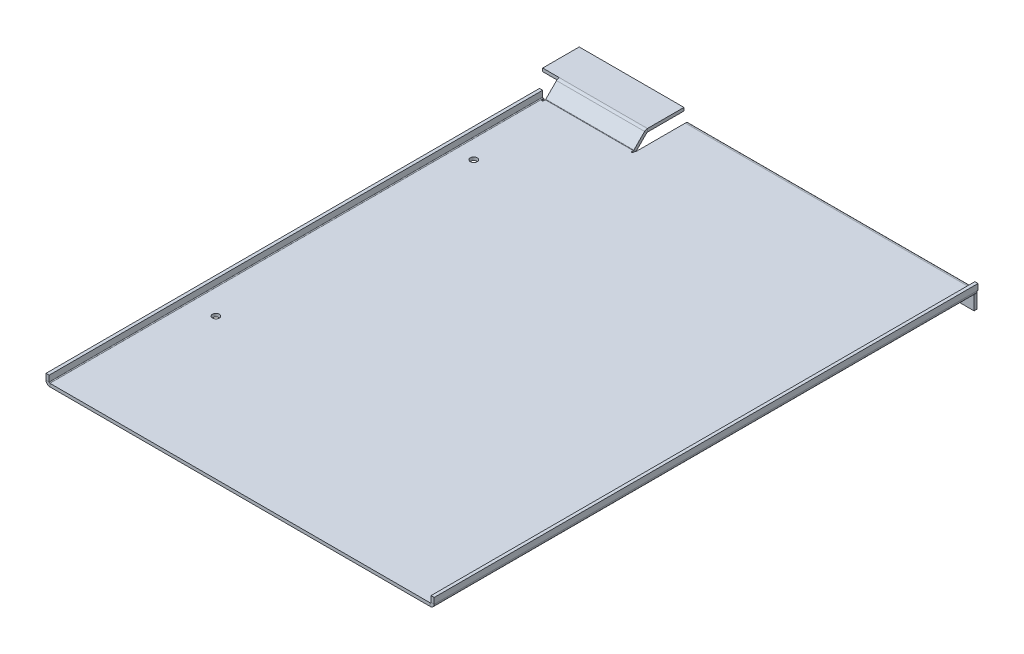
from build123d import *

# Parameters (mm, degrees)
SM_BASE_FLANGE_1_DEPTH           = 3
SM_EDGE_FLANGE_1_STRIP_W         = 13.48
SM_EDGE_FLANGE_1_STRIP_H         = 3
SM_EDGE_FLANGE_1_STRIP_CUT_DEPTH = 466.526743508
SM_EDGE_FLANGE_1_DEPTH           = 466.526743508
SM_EDGE_FLANGE_2_STRIP_W         = 13.48
SM_EDGE_FLANGE_2_STRIP_H         = 3
SM_EDGE_FLANGE_2_STRIP_CUT_DEPTH = 514.106826818
SM_EDGE_FLANGE_2_DEPTH           = 514.106826818
SM_START                         = -362.76
SM_EDGE_FLANGE_5_DEPTH           = 86.26
SM_START_2                       = -361.26
SM_EDGE_FLANGE_5_2_DEPTH         = 83.26
SM_START_3                       = -1
SM_EDGE_FLANGE_5_3_DEPTH         = 4.216740982
SM_EDGE_FLANGE_6_STRIP_CUT_DEPTH = 83.26
SM_EDGE_FLANGE_6_DEPTH           = 83.26
SM_START_4                       = 3
SM_EDGE_FLANGE_6_PROFILE_W       = 99
SM_EDGE_FLANGE_6_PROFILE_H       = 34.545643213
SM_EDGE_FLANGE_6_FLAT_DEPTH      = 3
SM_START_5                       = -3.74
SM_EDGE_FLANGE_7_DEPTH           = 4.74
SM_START_6                       = -276
SM_EDGE_FLANGE_7_2_DEPTH         = 272.26
SM_EDGE_FLANGE_7_3_DEPTH         = 272.26
SKETCH_29_R                      = 3.25
CUT_EXTRUDE_1_DEPTH              = 5


with BuildPart() as part:
    # Базовая кромка1: sheet metal written as solids
    # Sketch 1 → Базовая кромка1 (new body)
    with BuildSketch(Plane(origin=(0, 0, 0), x_dir=(1, 0, 0), z_dir=(0, 1, 0))):
        Polygon((-367, -536.526743508), (0, -536.526743508), (0, -22.41991669), (-276, -22.41991669), (-276, -70), (-367, -70), align=None)
    extrude(amount=SM_BASE_FLANGE_1_DEPTH)

    # Ребро-кромка1: sheet metal written as solids
    # Ребро-кромка1 strip (on a plane across the edge) → Ребро-кромка1 strip cut (cut)
    with BuildSketch(Plane(origin=(-367, 3, 70), x_dir=(1, 0, 0), z_dir=(0, 0, 1))):
        with Locations((-3, -1.5)):
            Rectangle(SM_EDGE_FLANGE_1_STRIP_W, SM_EDGE_FLANGE_1_STRIP_H)
    extrude(amount=SM_EDGE_FLANGE_1_STRIP_CUT_DEPTH, mode=Mode.SUBTRACT)

    # Ребро-кромка1 section (on a plane across the edge) → Ребро-кромка1 (add)
    with BuildSketch(Plane(origin=(-367, 3, 70), x_dir=(1, 0, 0), z_dir=(0, 0, 1))):
        with BuildLine():
            Line((0, 0.74), (0, 6.325908943))
            Line((0, 6.325908943), (3, 6.325908943))
            Line((3, 6.325908943), (3, 0.74))
            ThreePointArc((3, 0.74), (3.216740982, 0.216740982), (3.74, 0))
            Line((3.74, 0), (3.74, -3))
            ThreePointArc((3.74, -3), (1.095420638, -1.904579362), (0, 0.74))
        make_face()
    extrude(amount=SM_EDGE_FLANGE_1_DEPTH)

    # Ребро-кромка2: sheet metal written as solids
    # Ребро-кромка2 strip (on a plane across the edge) → Ребро-кромка2 strip cut (cut)
    with BuildSketch(Plane(origin=(0, 3, 536.526743508), x_dir=(-1, 0, 0), z_dir=(0, 0, -1))):
        with Locations((-3, -1.5)):
            Rectangle(SM_EDGE_FLANGE_2_STRIP_W, SM_EDGE_FLANGE_2_STRIP_H)
    extrude(amount=SM_EDGE_FLANGE_2_STRIP_CUT_DEPTH, mode=Mode.SUBTRACT)

    # Ребро-кромка2 section (on a plane across the edge) → Ребро-кромка2 (add)
    with BuildSketch(Plane(origin=(0, 3, 536.526743508), x_dir=(-1, 0, 0), z_dir=(0, 0, -1))):
        with BuildLine():
            Line((0, 0.74), (0, 6.325908943))
            Line((0, 6.325908943), (3, 6.325908943))
            Line((3, 6.325908943), (3, 0.74))
            ThreePointArc((3, 0.74), (3.216740982, 0.216740982), (3.74, 0))
            Line((3.74, 0), (3.74, -3))
            ThreePointArc((3.74, -3), (1.095420638, -1.904579362), (0, 0.74))
        make_face()
    extrude(amount=SM_EDGE_FLANGE_2_DEPTH)

    # Ребро-кромка5: read off the stored shape, not the designer's step
    # Ребро-кромка5 outline → Ребро-кромка5 (cut)
    with BuildSketch(Plane.YZ.offset(SM_START)):
        with BuildLine():
            Line((0, 70), (0.012581766, 70))
            ThreePointArc((0.012581766, 70), (0.003146765, 70.15312996), (0, 70.306518036))
            Line((0, 70.306518036), (0, 70))
        make_face()
    extrude(amount=SM_EDGE_FLANGE_5_DEPTH, mode=Mode.SUBTRACT)

    # Sm Edge Flange 5 2 outline → Sm Edge Flange 5 2 (add)
    with BuildSketch(Plane.YZ.offset(SM_START_2)):
        with BuildLine():
            ThreePointArc((0.012581766, 70), (0.346296855, 68.73477411), (1.095420638, 67.661938675))
            Line((1.095420638, 67.661938675), (11.485281374, 57.272077939))
            Line((11.485281374, 57.272077939), (13.606601718, 59.393398282))
            Line((13.606601718, 59.393398282), (3.216740982, 69.783259018))
            ThreePointArc((3.216740982, 69.783259018), (3.056329146, 70.023332296), (3, 70.306518036))
            Line((3, 70.306518036), (3, 70))
            Line((3, 70), (0.012581766, 70))
        make_face()
    extrude(amount=SM_EDGE_FLANGE_5_2_DEPTH)

    # Sm Edge Flange 5 3 outline → Sm Edge Flange 5 3 (cut)
    with BuildSketch(Plane(origin=(0, 0, 0), x_dir=(1, 0, 0), z_dir=(0, 1, 0)).offset(SM_START_3)):
        with BuildLine():
            ThreePointArc((-362.76, -71.806518036), (-362.01, -72.556518036), (-361.26, -71.806518036))
            Line((-361.26, -71.806518036), (-361.26, -70))
            Line((-361.26, -70), (-362.76, -70))
            Line((-362.76, -70), (-362.76, -71.806518036))
        make_face()
        with BuildLine():
            Line((-278, -70), (-278, -71.806518036))
            ThreePointArc((-278, -71.806518036), (-277.25, -72.556518036), (-276.5, -71.806518036))
            Line((-276.5, -71.806518036), (-276.5, -70))
            Line((-276.5, -70), (-278, -70))
        make_face()
    extrude(amount=SM_EDGE_FLANGE_5_3_DEPTH, mode=Mode.SUBTRACT)

    # Ребро-кромка6: sheet metal written as solids
    # Ребро-кромка6 strip (on a plane across the edge) → Ребро-кромка6 strip cut (cut)
    with BuildSketch(Plane(origin=(-361.26, 11.485281374, 57.272077939), x_dir=(0, -1, 0), z_dir=(1, 0, 0))):
        Polygon((-11.436378772, 7.193738085), (-1.904579362, -2.338061325), (0.216740982, -0.216740982), (-9.315058428, 9.315058428), align=None)
    extrude(amount=SM_EDGE_FLANGE_6_STRIP_CUT_DEPTH, mode=Mode.SUBTRACT)

    # Ребро-кромка6 bend section (on a plane across the edge) → Ребро-кромка6 (add)
    with BuildSketch(Plane(origin=(-361.26, 11.485281374, 57.272077939), x_dir=(0, -1, 0), z_dir=(1, 0, 0))):
        with BuildLine():
            Line((-3, 0.306518036), (0, 0.306518036))
            ThreePointArc((0, 0.306518036), (0.056329146, 0.023332296), (0.216740982, -0.216740982))
            Line((0.216740982, -0.216740982), (-1.904579362, -2.338061325))
            ThreePointArc((-1.904579362, -2.338061325), (-2.715309452, -1.124718001), (-3, 0.306518036))
        make_face()
    extrude(amount=SM_EDGE_FLANGE_6_DEPTH)

    # Ребро-кромка6 profile (on flange) → Ребро-кромка6 flat (add)
    with BuildSketch(Plane(origin=(0, 11.485281374, 57.272077939), x_dir=(1, 0, 0), z_dir=(0, 1, 0)).offset(SM_START_4)):
        with Locations((-327.5, 17.579339643)):
            Rectangle(SM_EDGE_FLANGE_6_PROFILE_W, SM_EDGE_FLANGE_6_PROFILE_H)
    extrude(amount=-SM_EDGE_FLANGE_6_FLAT_DEPTH)

    # Ребро-кромка7: read off the stored shape, not the designer's step
    # Ребро-кромка7 outline → Ребро-кромка7 (cut)
    with BuildSketch(Plane.YZ.offset(SM_START_5)):
        with BuildLine():
            Line((3.74, 22.41991669), (3.74, 23.15991669))
            Line((3.74, 23.15991669), (0, 23.15991669))
            ThreePointArc((0, 23.15991669), (-0.216740982, 22.636657672), (-0.74, 22.41991669))
            Line((-0.74, 22.41991669), (-15, 22.41991669))
            Line((-15, 22.41991669), (-15, 19.41991669))
            Line((-15, 19.41991669), (-0.74, 19.41991669))
            ThreePointArc((-0.74, 19.41991669), (1.628543857, 20.265508287), (2.926060556, 22.41991669))
            Line((2.926060556, 22.41991669), (3.74, 22.41991669))
        make_face()
    extrude(amount=SM_EDGE_FLANGE_7_DEPTH, mode=Mode.SUBTRACT)

    # Sm Edge Flange 7 2 outline → Sm Edge Flange 7 2 (cut)
    with BuildSketch(Plane.YZ.offset(SM_START_6)):
        with BuildLine():
            Line((2.926060556, 22.41991669), (3.74, 22.41991669))
            Line((3.74, 22.41991669), (3.74, 23.15991669))
            Line((3.74, 23.15991669), (3, 23.15991669))
            ThreePointArc((3, 23.15991669), (2.981469231, 22.788074304), (2.926060556, 22.41991669))
        make_face()
    extrude(amount=SM_EDGE_FLANGE_7_2_DEPTH, mode=Mode.SUBTRACT)

    # Sm Edge Flange 7 3 outline → Sm Edge Flange 7 3 (add)
    with BuildSketch(Plane.YZ.offset(SM_START_6)):
        with BuildLine():
            ThreePointArc((2.926060556, 22.41991669), (2.981469231, 22.788074304), (3, 23.15991669))
            Line((3, 23.15991669), (0, 23.15991669))
            ThreePointArc((0, 23.15991669), (-0.216740982, 22.636657672), (-0.74, 22.41991669))
            Line((-0.74, 22.41991669), (-15, 22.41991669))
            Line((-15, 22.41991669), (-15, 19.41991669))
            Line((-15, 19.41991669), (-0.74, 19.41991669))
            ThreePointArc((-0.74, 19.41991669), (1.628543857, 20.265508287), (2.926060556, 22.41991669))
        make_face()
    extrude(amount=SM_EDGE_FLANGE_7_3_DEPTH)

    # Эскиз29 → Вырез-Вытянуть1 (cut)
    with BuildSketch(Plane(origin=(0, 3, 0), x_dir=(1, 0, 0), z_dir=(0, 1, 0))):
        with Locations(Location((-345.974710107, -153.138626068, 0), (0, 0, 270))):
            Circle(SKETCH_29_R)
        with Locations(Location((-339.843991697, -403.063443347, 0), (0, 0, 270))):
            Circle(SKETCH_29_R)
    extrude(amount=-CUT_EXTRUDE_1_DEPTH, mode=Mode.SUBTRACT)


solid = part.part
